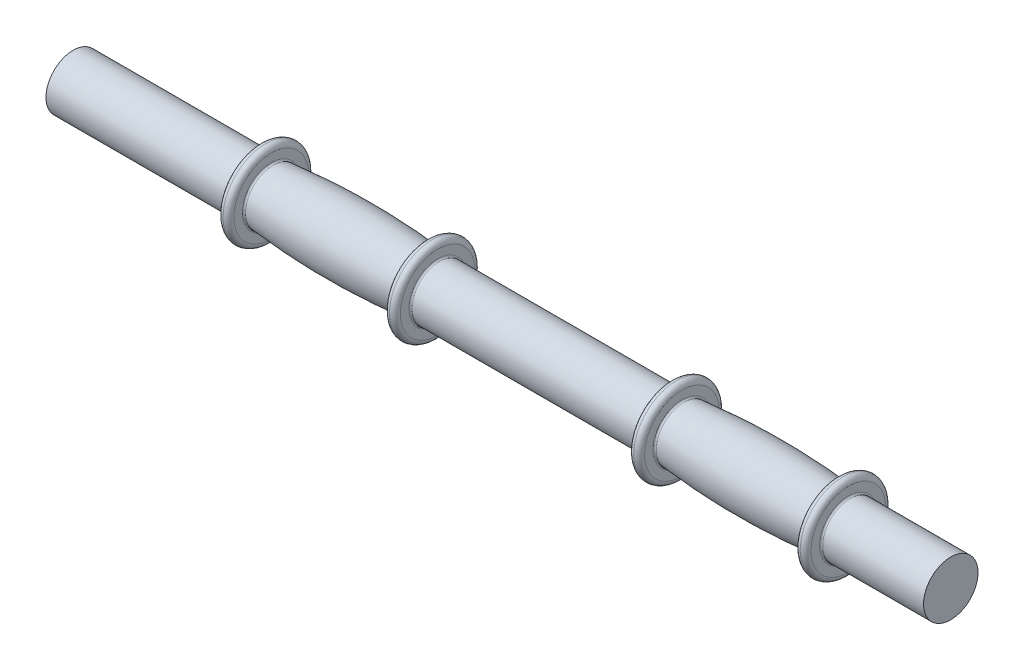
from build123d import *

# Parameters (mm, degrees)
FILLET4_R           = 3.5
FILLET5_R           = 1
SKETCH3_R           = 12.5
BOSS_EXTRUDE1_DEPTH = 564.12
SKETCH3_2_R         = 12.5
CUT_EXTRUDE2_DEPTH  = 559.12


with BuildPart() as part:
    # Sketch1 → Revolve1 (revolve)
    with BuildSketch(Plane.XY, mode=Mode.PRIVATE) as revolve1_sk:
        with BuildLine():
            Line((0, 0), (0, 17.5))
            Line((0, 17.5), (120.32, 17.5))
            Line((120.32, 17.5), (120.32, 27.5))
            Line((120.32, 27.5), (127.32, 27.5))
            Line((127.32, 27.5), (127.32, 17.5))
            add(Edge.make_bspline(
                [(127.32, 17.5), (177.32, 22.5), (227.32, 17.5)],
                knots=[0, 0, 0, 1, 1, 1], degree=2))
            Line((227.32, 17.5), (227.32, 27.5))
            Line((227.32, 27.5), (234.32, 27.5))
            Line((234.32, 27.5), (234.32, 17.5))
            Line((234.32, 17.5), (384.32, 17.5))
            Line((384.32, 17.5), (384.32, 27.5))
            Line((384.32, 27.5), (391.32, 27.5))
            Line((391.32, 27.5), (391.32, 17.5))
            add(Edge.make_bspline(
                [(391.32, 17.5), (441.32, 22.5), (491.32, 17.5)],
                knots=[0, 0, 0, 1, 1, 1], degree=2))
            Line((491.32, 17.5), (491.32, 27.5))
            Line((491.32, 27.5), (498.32, 27.5))
            Line((498.32, 27.5), (498.32, 17.5))
            Line((498.32, 17.5), (564.12, 17.5))
            Line((564.12, 17.5), (564.12, 0))
            Line((564.12, 0), (0, 0))
        make_face()
    revolve(revolve1_sk.sketch.rotate(Axis((564.12, 0, 0), (-1, 0, 0)), 90), axis=Axis((564.12, 0, 0), (-1, 0, 0)))

    # Fillet4
    fillet4_edges = [part.edges().sort_by_distance(p)[0] for p in [
        (120.32, 0, 27.5),
        (127.32, 0, 27.5),
        (227.32, 0, 27.5),
        (234.32, 0, 27.5),
        (384.32, 0, 27.5),
        (391.32, 0, 27.5),
        (491.32, 0, 27.5),
        (498.32, 0, 27.5),
    ]]
    fillet(fillet4_edges, radius=FILLET4_R - 0.0001)  # a hair under: the kernel refuses the full size

    # Fillet5
    fillet5_edges = [part.edges().sort_by_distance(p)[0] for p in [
        (120.32, 0, 17.5),
        (127.32, 0, 17.5),
        (227.32, 0, 17.5),
        (234.32, 0, 17.5),
        (384.32, 0, 17.5),
        (391.32, 0, 17.5),
        (491.32, 0, 17.5),
        (498.32, 0, 17.5),
    ]]
    fillet(fillet5_edges, radius=FILLET5_R)

    # Sketch3 → Boss-Extrude1 (add, through all)
    with BuildSketch(Plane.ZY):
        Circle(SKETCH3_R)
    extrude(amount=-BOSS_EXTRUDE1_DEPTH)

    # Sketch3<2> → Cut-Extrude2 (cut)
    with BuildSketch(Plane.ZY):
        Circle(SKETCH3_2_R)
    extrude(amount=-CUT_EXTRUDE2_DEPTH, mode=Mode.SUBTRACT)


solid = part.part
